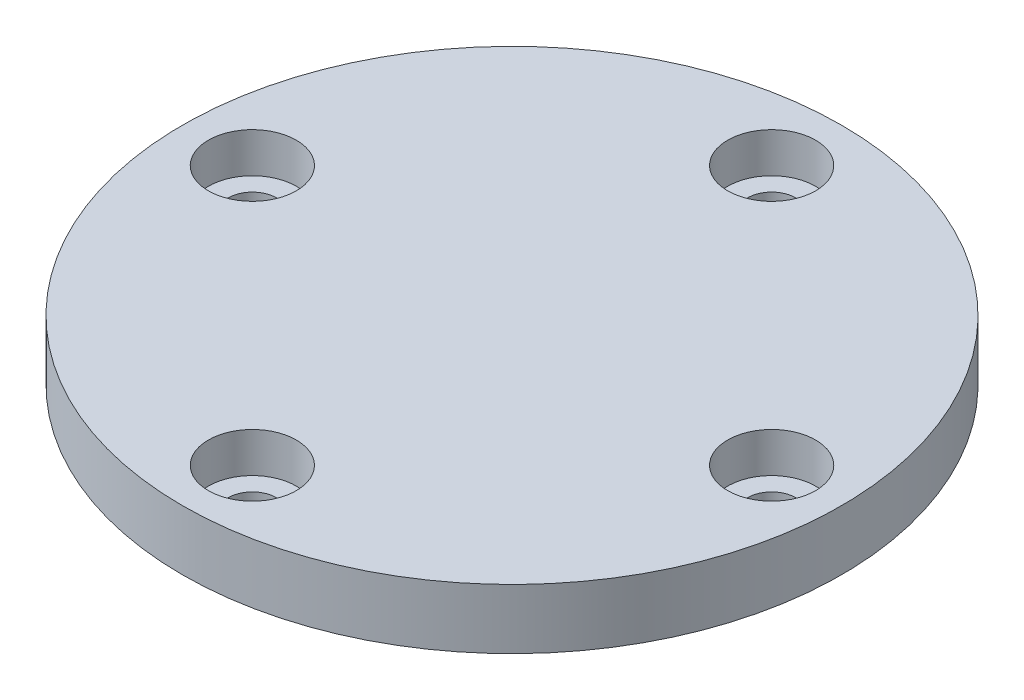
from build123d import *

# Parameters (mm, degrees)
SKETCH1_R                      = 16.5
BOSS_EXTRUDE1_DEPTH            = 3
CBORE_FOR_M2_SHCS1_D           = 2.4
CBORE_FOR_M2_SHCS1_CBORE_D     = 4.4
CBORE_FOR_M2_SHCS1_CBORE_DEPTH = 2
CIRPATTERN1_COUNT              = 4
SKETCH8_R                      = 9
BOSS_EXTRUDE2_DEPTH            = 2
SKETCH9_R                      = 0.425
CUT_EXTRUDE1_DEPTH             = 1.5


with BuildPart() as part:
    # Sketch1 → Boss-Extrude1 (new body)
    with BuildSketch(Plane(origin=(0, 0, 0), x_dir=(1, 0, 0), z_dir=(0, 1, 0))):
        Circle(SKETCH1_R)
    extrude(amount=BOSS_EXTRUDE1_DEPTH)

    # CBORE for M2 SHCS1 (through all)
    with Locations(Plane(origin=(0, 3, 0), x_dir=(1, 0, 0), z_dir=(0, 1, 0))):
        with Locations((13, 0)):
            cbore_for_m2_shcs1 = CounterBoreHole(CBORE_FOR_M2_SHCS1_D / 2, CBORE_FOR_M2_SHCS1_CBORE_D / 2, CBORE_FOR_M2_SHCS1_CBORE_DEPTH)

    # CirPattern1: CBORE for M2 SHCS1 ×4 about axis
    cirpattern1_axis = Axis((0, 3, 0), (0, 1, 0))
    for i in range(1, CIRPATTERN1_COUNT):
        add(cbore_for_m2_shcs1.rotate(cirpattern1_axis, i * 360 / CIRPATTERN1_COUNT), mode=Mode.SUBTRACT)

    # Sketch8 → Boss-Extrude2 (add)
    with BuildSketch(Plane.XZ):
        Circle(SKETCH8_R)
    extrude(amount=BOSS_EXTRUDE2_DEPTH)

    # Sketch9 → Cut-Extrude1 (cut)
    with BuildSketch(Plane.XZ.offset(2)):
        with Locations((6, 0)):
            Circle(SKETCH9_R)
    extrude(amount=-CUT_EXTRUDE1_DEPTH, mode=Mode.SUBTRACT)


solid = part.part
